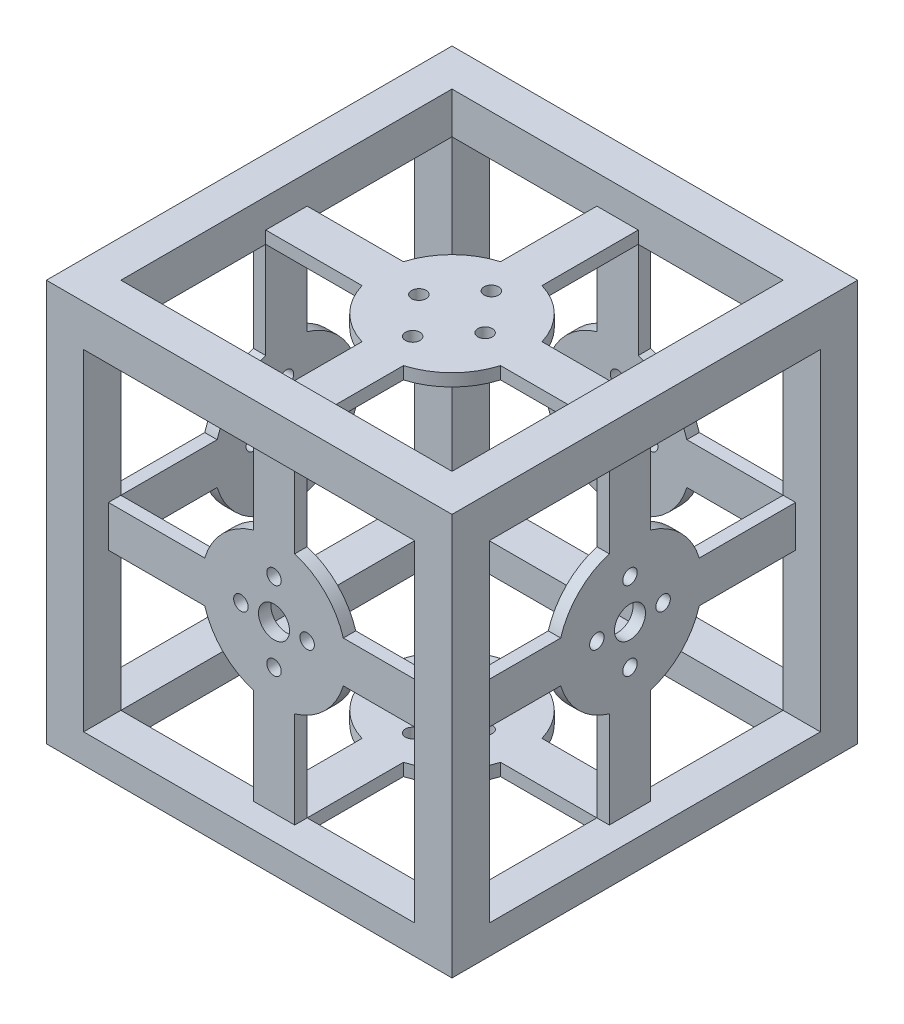
from build123d import *

# Parameters (mm, degrees)
SKETCH2_R                  = 1.75
SKETCH2_W                  = 10
SKETCH2_H                  = 10
BOSS_EXTRUDE1_DEPTH        = 3
CIRPATTERN1_COUNT          = 4
CIRPATTERN2_START          = 40
CIRPATTERN2_OUTLINE_R      = 1.75
CIRPATTERN2_DEPTH          = 3
CIRPATTERN2_START_2        = -43
CIRPATTERN2_2_OUTLINE_R    = 1.75
CIRPATTERN2_2_DEPTH        = 3
CIRPATTERN2_3_OUTLINE_R    = 1.75
CIRPATTERN2_3_DEPTH        = 3
CIRPATTERN2_4_OUTLINE_R    = 1.75
CIRPATTERN2_4_DEPTH        = 3
BOSS_EXTRUDE2_DEPTH        = 50
BOSS_EXTRUDE2_DEPTH_BACK   = 50
SKETCH3_W                  = 10
SKETCH3_H                  = 10
BOSS_EXTRUDE2_2_DEPTH      = 50
BOSS_EXTRUDE2_2_DEPTH_BACK = 50
BOSS_EXTRUDE2_3_DEPTH      = 50
BOSS_EXTRUDE2_3_DEPTH_BACK = 50
BOSS_EXTRUDE2_4_DEPTH      = 50
BOSS_EXTRUDE2_4_DEPTH_BACK = 50
SKETCH4_W                  = 100
SKETCH4_H                  = 100
SKETCH4_W_2                = 80
SKETCH4_H_2                = 80
BOSS_EXTRUDE3_DEPTH        = 10
SKETCH5_W                  = 100
SKETCH5_H                  = 100
SKETCH5_W_2                = 80
SKETCH5_H_2                = 80
BOSS_EXTRUDE4_DEPTH        = 10
SKETCH7_R                  = 3.75
CUT_EXTRUDE2_DEPTH         = 10
SKETCH8_R                  = 3.75
CUT_EXTRUDE3_DEPTH         = 117.828934772
SKETCH9_R                  = 3.75
CUT_EXTRUDE4_DEPTH         = 117.828934772
SKETCH10_W                 = 100
SKETCH10_H                 = 100
CUT_EXTRUDE5_DEPTH         = 3
SKETCH11_W                 = 100
SKETCH11_H                 = 97
CUT_EXTRUDE6_DEPTH         = 1
SKETCH12_W                 = 99
SKETCH12_H                 = 97
CUT_EXTRUDE7_DEPTH         = 1
SKETCH13_W                 = 99
SKETCH13_H                 = 97
CUT_EXTRUDE8_DEPTH         = 1
SKETCH14_W                 = 98
SKETCH14_H                 = 97
CUT_EXTRUDE9_DEPTH         = 1


# Read off the part's stored shape, not the designer's step: CirPattern2
with BuildPart() as part:
    # Sketch2 → Boss-Extrude1 (new body)
    # profile 1 of 13: a face of its own
    with BuildSketch(Plane.XY.offset(40)):
        with BuildLine():
            ThreePointArc((5, -16.74259435), (0, -17.47325), (-5, -16.74259435))
            Line((-5, -16.74259435), (-5, -50))
            Line((-5, -50), (5, -50))
            Line((5, -50), (5, -16.74259435))
        make_face()
    # profile 2 of 13: a face of its own
    with BuildSketch(Plane.XY.offset(40)):
        with BuildLine():
            Line((5, -5), (-5, -5))
            Line((-5, -5), (-5, -16.74259435))
            ThreePointArc((-5, -16.74259435), (0, -17.47325), (5, -16.74259435))
            Line((5, -16.74259435), (5, -5))
        make_face()
        with Locations((0, -9.5)):
            Circle(SKETCH2_R, mode=Mode.SUBTRACT)
    # profile 3 of 13: a face of its own
    with BuildSketch(Plane.XY.offset(40)):
        with BuildLine():
            Line((16.74259435, -5), (5, -5))
            Line((5, -5), (5, -16.74259435))
            ThreePointArc((5, -16.74259435), (12.355453564, -12.355453564), (16.74259435, -5))
        make_face()
    # profile 4 of 13: a face of its own
    with BuildSketch(Plane.XY.offset(40)):
        with BuildLine():
            Line((5, 5), (5, -5))
            Line((5, -5), (16.74259435, -5))
            ThreePointArc((16.74259435, -5), (17.289621197, -2.526551883), (17.47325, 0))
            ThreePointArc((17.47325, 0), (17.289621197, 2.526551883), (16.74259435, 5))
            Line((16.74259435, 5), (5, 5))
        make_face()
        with Locations((8, 0)):
            Circle(SKETCH2_R, mode=Mode.SUBTRACT)
    # profile 5 of 13: a face of its own
    with BuildSketch(Plane.XY.offset(40)):
        Rectangle(SKETCH2_W, SKETCH2_H)
    # profile 6 of 13: a face of its own
    with BuildSketch(Plane.XY.offset(40)):
        with BuildLine():
            Line((-5, -5), (-16.74259435, -5))
            ThreePointArc((-16.74259435, -5), (-12.355453564, -12.355453564), (-5, -16.74259435))
            Line((-5, -16.74259435), (-5, -5))
        make_face()
    # profile 7 of 13: a face of its own
    with BuildSketch(Plane.XY.offset(40)):
        with BuildLine():
            ThreePointArc((-16.74259435, 5), (-17.47325, 0), (-16.74259435, -5))
            Line((-16.74259435, -5), (-5, -5))
            Line((-5, -5), (-5, 5))
            Line((-5, 5), (-16.74259435, 5))
        make_face()
        with Locations((-8, 0)):
            Circle(SKETCH2_R, mode=Mode.SUBTRACT)
    # profile 8 of 13: a face of its own
    with BuildSketch(Plane.XY.offset(40)):
        with BuildLine():
            ThreePointArc((-5, 16.74259435), (-12.355453564, 12.355453564), (-16.74259435, 5))
            Line((-16.74259435, 5), (-5, 5))
            Line((-5, 5), (-5, 16.74259435))
        make_face()
    # profile 9 of 13: a face of its own
    with BuildSketch(Plane.XY.offset(40)):
        with BuildLine():
            Line((-5, 16.74259435), (-5, 5))
            Line((-5, 5), (5, 5))
            Line((5, 5), (5, 16.74259435))
            ThreePointArc((5, 16.74259435), (0, 17.47325), (-5, 16.74259435))
        make_face()
        with Locations((0, 9.5)):
            Circle(SKETCH2_R, mode=Mode.SUBTRACT)
    # profile 10 of 13: a face of its own
    with BuildSketch(Plane.XY.offset(40)):
        with BuildLine():
            Line((5, 16.74259435), (5, 5))
            Line((5, 5), (16.74259435, 5))
            ThreePointArc((16.74259435, 5), (12.355453564, 12.355453564), (5, 16.74259435))
        make_face()
    # profile 11 of 13: a face of its own
    with BuildSketch(Plane.XY.offset(40)):
        with BuildLine():
            ThreePointArc((17.47325, 0), (17.289621197, -2.526551883), (16.74259435, -5))
            Line((16.74259435, -5), (50, -5))
            Line((50, -5), (50, 5))
            Line((50, 5), (16.74259435, 5))
            ThreePointArc((16.74259435, 5), (17.289621197, 2.526551883), (17.47325, 0))
        make_face()
    # profile 12 of 13: a face of its own
    with BuildSketch(Plane.XY.offset(40)):
        with BuildLine():
            Line((-50, 5), (-50, -5))
            Line((-50, -5), (-16.74259435, -5))
            ThreePointArc((-16.74259435, -5), (-17.47325, 0), (-16.74259435, 5))
            Line((-16.74259435, 5), (-50, 5))
        make_face()
    # profile 13 of 13: a face of its own
    with BuildSketch(Plane.XY.offset(40)):
        with BuildLine():
            Line((-5, 50), (-5, 16.74259435))
            ThreePointArc((-5, 16.74259435), (0, 17.47325), (5, 16.74259435))
            Line((5, 16.74259435), (5, 50))
            Line((5, 50), (-5, 50))
        make_face()
    extrude(amount=BOSS_EXTRUDE1_DEPTH)


with BuildPart() as cirpattern1_1:
    # CirPattern1: pattern copy
    add(part.part.rotate(Axis((0, 0, 0), (1, 0, 0)), 1 * 360 / CIRPATTERN1_COUNT))


with BuildPart() as cirpattern1_2:
    # CirPattern1: pattern copy
    add(part.part.rotate(Axis((0, 0, 0), (1, 0, 0)), 2 * 360 / CIRPATTERN1_COUNT))


with BuildPart() as cirpattern1_3:
    # CirPattern1: pattern copy
    add(part.part.rotate(Axis((0, 0, 0), (1, 0, 0)), 3 * 360 / CIRPATTERN1_COUNT))


with BuildPart() as body_5:
    # CirPattern2 outline → CirPattern2 (new body)
    with BuildSketch(Plane.XY.offset(CIRPATTERN2_START)):
        with BuildLine():
            ThreePointArc((5, -16.74259435), (12.355453564, -12.355453564), (16.74259435, -5))
            Line((16.74259435, -5), (50, -5))
            Line((50, -5), (50, 5))
            Line((50, 5), (16.74259435, 5))
            ThreePointArc((16.74259435, 5), (12.355453564, 12.355453564), (5, 16.74259435))
            Line((5, 16.74259435), (5, 50))
            Line((5, 50), (-5, 50))
            Line((-5, 50), (-5, 16.74259435))
            ThreePointArc((-5, 16.74259435), (-12.355453564, 12.355453564), (-16.74259435, 5))
            Line((-16.74259435, 5), (-50, 5))
            Line((-50, 5), (-50, -5))
            Line((-50, -5), (-16.74259435, -5))
            ThreePointArc((-16.74259435, -5), (-12.355453564, -12.355453564), (-5, -16.74259435))
            Line((-5, -16.74259435), (-5, -50))
            Line((-5, -50), (5, -50))
            Line((5, -50), (5, -16.74259435))
        make_face()
        with Locations((0, -9.5)):
            Circle(CIRPATTERN2_OUTLINE_R, mode=Mode.SUBTRACT)
        with Locations((-8, 0)):
            Circle(CIRPATTERN2_OUTLINE_R, mode=Mode.SUBTRACT)
        with Locations((8, 0)):
            Circle(CIRPATTERN2_OUTLINE_R, mode=Mode.SUBTRACT)
        with Locations((0, 9.5)):
            Circle(CIRPATTERN2_OUTLINE_R, mode=Mode.SUBTRACT)
    extrude(amount=CIRPATTERN2_DEPTH)


with BuildPart() as body_6:
    # CirPattern2 2 outline → CirPattern2 2 (new body)
    with BuildSketch(Plane.YZ.offset(CIRPATTERN2_START_2)):
        with BuildLine():
            Line((-5, 50), (-5, 16.74259435))
            ThreePointArc((-5, 16.74259435), (-12.355453564, 12.355453564), (-16.74259435, 5))
            Line((-16.74259435, 5), (-50, 5))
            Line((-50, 5), (-50, -5))
            Line((-50, -5), (-16.74259435, -5))
            ThreePointArc((-16.74259435, -5), (-12.355453564, -12.355453564), (-5, -16.74259435))
            Line((-5, -16.74259435), (-5, -50))
            Line((-5, -50), (5, -50))
            Line((5, -50), (5, -16.74259435))
            ThreePointArc((5, -16.74259435), (12.355453564, -12.355453564), (16.74259435, -5))
            Line((16.74259435, -5), (50, -5))
            Line((50, -5), (50, 5))
            Line((50, 5), (16.74259435, 5))
            ThreePointArc((16.74259435, 5), (12.355453564, 12.355453564), (5, 16.74259435))
            Line((5, 16.74259435), (5, 50))
            Line((5, 50), (-5, 50))
        make_face()
        with Locations((0, -8)):
            Circle(CIRPATTERN2_2_OUTLINE_R, mode=Mode.SUBTRACT)
        with Locations((-9.5, 0)):
            Circle(CIRPATTERN2_2_OUTLINE_R, mode=Mode.SUBTRACT)
        with Locations((9.5, 0)):
            Circle(CIRPATTERN2_2_OUTLINE_R, mode=Mode.SUBTRACT)
        with Locations((0, 8)):
            Circle(CIRPATTERN2_2_OUTLINE_R, mode=Mode.SUBTRACT)
    extrude(amount=CIRPATTERN2_2_DEPTH)


with BuildPart() as body_7:
    # CirPattern2 3 outline → CirPattern2 3 (new body)
    with BuildSketch(Plane.YZ.offset(CIRPATTERN2_START)):
        with BuildLine():
            ThreePointArc((-16.74259435, -5), (-12.355453564, -12.355453564), (-5, -16.74259435))
            Line((-5, -16.74259435), (-5, -50))
            Line((-5, -50), (5, -50))
            Line((5, -50), (5, -16.74259435))
            ThreePointArc((5, -16.74259435), (12.355453564, -12.355453564), (16.74259435, -5))
            Line((16.74259435, -5), (50, -5))
            Line((50, -5), (50, 5))
            Line((50, 5), (16.74259435, 5))
            ThreePointArc((16.74259435, 5), (12.355453564, 12.355453564), (5, 16.74259435))
            Line((5, 16.74259435), (5, 50))
            Line((5, 50), (-5, 50))
            Line((-5, 50), (-5, 16.74259435))
            ThreePointArc((-5, 16.74259435), (-12.355453564, 12.355453564), (-16.74259435, 5))
            Line((-16.74259435, 5), (-50, 5))
            Line((-50, 5), (-50, -5))
            Line((-50, -5), (-16.74259435, -5))
        make_face()
        with Locations((0, -8)):
            Circle(CIRPATTERN2_3_OUTLINE_R, mode=Mode.SUBTRACT)
        with Locations((-9.5, 0)):
            Circle(CIRPATTERN2_3_OUTLINE_R, mode=Mode.SUBTRACT)
        with Locations((9.5, 0)):
            Circle(CIRPATTERN2_3_OUTLINE_R, mode=Mode.SUBTRACT)
        with Locations((0, 8)):
            Circle(CIRPATTERN2_3_OUTLINE_R, mode=Mode.SUBTRACT)
    extrude(amount=CIRPATTERN2_3_DEPTH)


with BuildPart() as body_8:
    # CirPattern2 4 outline → CirPattern2 4 (new body)
    with BuildSketch(Plane.XY.offset(CIRPATTERN2_START_2)):
        with BuildLine():
            Line((50, 5), (16.74259435, 5))
            ThreePointArc((16.74259435, 5), (12.355453564, 12.355453564), (5, 16.74259435))
            Line((5, 16.74259435), (5, 50))
            Line((5, 50), (-5, 50))
            Line((-5, 50), (-5, 16.74259435))
            ThreePointArc((-5, 16.74259435), (-12.355453564, 12.355453564), (-16.74259435, 5))
            Line((-16.74259435, 5), (-50, 5))
            Line((-50, 5), (-50, -5))
            Line((-50, -5), (-16.74259435, -5))
            ThreePointArc((-16.74259435, -5), (-12.355453564, -12.355453564), (-5, -16.74259435))
            Line((-5, -16.74259435), (-5, -50))
            Line((-5, -50), (5, -50))
            Line((5, -50), (5, -16.74259435))
            ThreePointArc((5, -16.74259435), (12.355453564, -12.355453564), (16.74259435, -5))
            Line((16.74259435, -5), (50, -5))
            Line((50, -5), (50, 5))
        make_face()
        with Locations((0, -9.5)):
            Circle(CIRPATTERN2_4_OUTLINE_R, mode=Mode.SUBTRACT)
        with Locations((-8, 0)):
            Circle(CIRPATTERN2_4_OUTLINE_R, mode=Mode.SUBTRACT)
        with Locations((8, 0)):
            Circle(CIRPATTERN2_4_OUTLINE_R, mode=Mode.SUBTRACT)
        with Locations((0, 9.5)):
            Circle(CIRPATTERN2_4_OUTLINE_R, mode=Mode.SUBTRACT)
    extrude(amount=CIRPATTERN2_4_DEPTH)


with BuildPart() as body_9:
    # Sketch3 → Boss-Extrude2 (new, two sides: drawn at the far end of the back side and taken through both)
    with BuildSketch(Plane(origin=(0, 0, 0), x_dir=(1, 0, 0), z_dir=(0, 1, 0)).offset(-BOSS_EXTRUDE2_DEPTH_BACK)):
        with Locations((-45, -45)):
            Rectangle(SKETCH3_W, SKETCH3_H)
    extrude(amount=BOSS_EXTRUDE2_DEPTH + BOSS_EXTRUDE2_DEPTH_BACK)


with BuildPart() as body_10:
    # Sketch3 → Boss-Extrude2 2 (new, two sides: drawn at the far end of the back side and taken through both)
    with BuildSketch(Plane(origin=(0, 0, 0), x_dir=(1, 0, 0), z_dir=(0, 1, 0)).offset(-BOSS_EXTRUDE2_2_DEPTH_BACK)):
        with Locations((45, -45)):
            Rectangle(SKETCH3_W, SKETCH3_H)
    extrude(amount=BOSS_EXTRUDE2_2_DEPTH + BOSS_EXTRUDE2_2_DEPTH_BACK)


with BuildPart() as body_11:
    # Sketch3 → Boss-Extrude2 3 (new, two sides: drawn at the far end of the back side and taken through both)
    with BuildSketch(Plane(origin=(0, 0, 0), x_dir=(1, 0, 0), z_dir=(0, 1, 0)).offset(-BOSS_EXTRUDE2_3_DEPTH_BACK)):
        with Locations((45, 45)):
            Rectangle(SKETCH3_W, SKETCH3_H)
    extrude(amount=BOSS_EXTRUDE2_3_DEPTH + BOSS_EXTRUDE2_3_DEPTH_BACK)


with BuildPart() as body_12:
    # Sketch3 → Boss-Extrude2 4 (new, two sides: drawn at the far end of the back side and taken through both)
    with BuildSketch(Plane(origin=(0, 0, 0), x_dir=(1, 0, 0), z_dir=(0, 1, 0)).offset(-BOSS_EXTRUDE2_4_DEPTH_BACK)):
        with Locations((-45, 45)):
            Rectangle(SKETCH3_W, SKETCH3_H)
    extrude(amount=BOSS_EXTRUDE2_4_DEPTH + BOSS_EXTRUDE2_4_DEPTH_BACK)


with BuildPart() as part_1:
    add(part.part)

    add(cirpattern1_1.part)  # Boss-Extrude3 merges CirPattern1_1

    add(cirpattern1_2.part)  # Boss-Extrude3 merges CirPattern1_2

    add(body_5.part)  # Boss-Extrude3 merges body 5

    add(body_6.part)  # Boss-Extrude3 merges body 6

    add(body_7.part)  # Boss-Extrude3 merges body 7

    add(body_8.part)  # Boss-Extrude3 merges body 8

    add(body_9.part)  # Boss-Extrude3 merges body 9

    add(body_10.part)  # Boss-Extrude3 merges body 10

    add(body_11.part)  # Boss-Extrude3 merges body 11

    add(body_12.part)  # Boss-Extrude3 merges body 12
    # Sketch4 → Boss-Extrude3 (add)
    with BuildSketch(Plane.XZ.offset(50)):
        Rectangle(SKETCH4_W, SKETCH4_H)
        Rectangle(SKETCH4_W_2, SKETCH4_H_2, mode=Mode.SUBTRACT)
    extrude(amount=-BOSS_EXTRUDE3_DEPTH)

    add(cirpattern1_3.part)  # Boss-Extrude4 merges CirPattern1_3
    # Sketch5 → Boss-Extrude4 (add)
    with BuildSketch(Plane(origin=(0, 50, 0), x_dir=(1, 0, 0), z_dir=(0, 1, 0))):
        Rectangle(SKETCH5_W, SKETCH5_H)
        Rectangle(SKETCH5_W_2, SKETCH5_H_2, mode=Mode.SUBTRACT)
    extrude(amount=-BOSS_EXTRUDE4_DEPTH)

    # Sketch7 → Cut-Extrude2 (cut)
    with BuildSketch(Plane.XZ.offset(43)):
        with Locations(Location((0, 0, 0), (0, 0, 270))):
            Circle(SKETCH7_R)
    extrude(amount=-CUT_EXTRUDE2_DEPTH, mode=Mode.SUBTRACT)

    # Sketch8 → Cut-Extrude3 (cut, through all)
    with BuildSketch(Plane.ZY.offset(43)):
        Circle(SKETCH8_R)
    extrude(amount=-CUT_EXTRUDE3_DEPTH, mode=Mode.SUBTRACT)

    # Sketch9 → Cut-Extrude4 (cut, through all)
    with BuildSketch(Plane(origin=(0, 0, -43), x_dir=(-1, 0, 0), z_dir=(0, 0, -1))):
        Circle(SKETCH9_R)
    extrude(amount=-CUT_EXTRUDE4_DEPTH, mode=Mode.SUBTRACT)

    # Sketch10 → Cut-Extrude5 (cut)
    with BuildSketch(Plane.XZ.offset(50)):
        Rectangle(SKETCH10_W, SKETCH10_H)
    extrude(amount=-CUT_EXTRUDE5_DEPTH, mode=Mode.SUBTRACT)

    # Sketch11 → Cut-Extrude6 (cut)
    with BuildSketch(Plane.ZY.offset(50)):
        with Locations((0, 1.5)):
            Rectangle(SKETCH11_W, SKETCH11_H)
    extrude(amount=-CUT_EXTRUDE6_DEPTH, mode=Mode.SUBTRACT)

    # Sketch12 → Cut-Extrude7 (cut)
    with BuildSketch(Plane.XY.offset(50)):
        with Locations((0.5, 1.5)):
            Rectangle(SKETCH12_W, SKETCH12_H)
    extrude(amount=-CUT_EXTRUDE7_DEPTH, mode=Mode.SUBTRACT)

    # Sketch13 → Cut-Extrude8 (cut)
    with BuildSketch(Plane(origin=(50, 0, 0), x_dir=(0, 0, -1), z_dir=(1, 0, 0))):
        with Locations((0.5, 1.5)):
            Rectangle(SKETCH13_W, SKETCH13_H)
    extrude(amount=-CUT_EXTRUDE8_DEPTH, mode=Mode.SUBTRACT)

    # Sketch14 → Cut-Extrude9 (cut)
    with BuildSketch(Plane(origin=(0, 0, -50), x_dir=(-1, 0, 0), z_dir=(0, 0, -1))):
        with Locations((0, 1.5)):
            Rectangle(SKETCH14_W, SKETCH14_H)
    extrude(amount=-CUT_EXTRUDE9_DEPTH, mode=Mode.SUBTRACT)


solid = part_1.part
